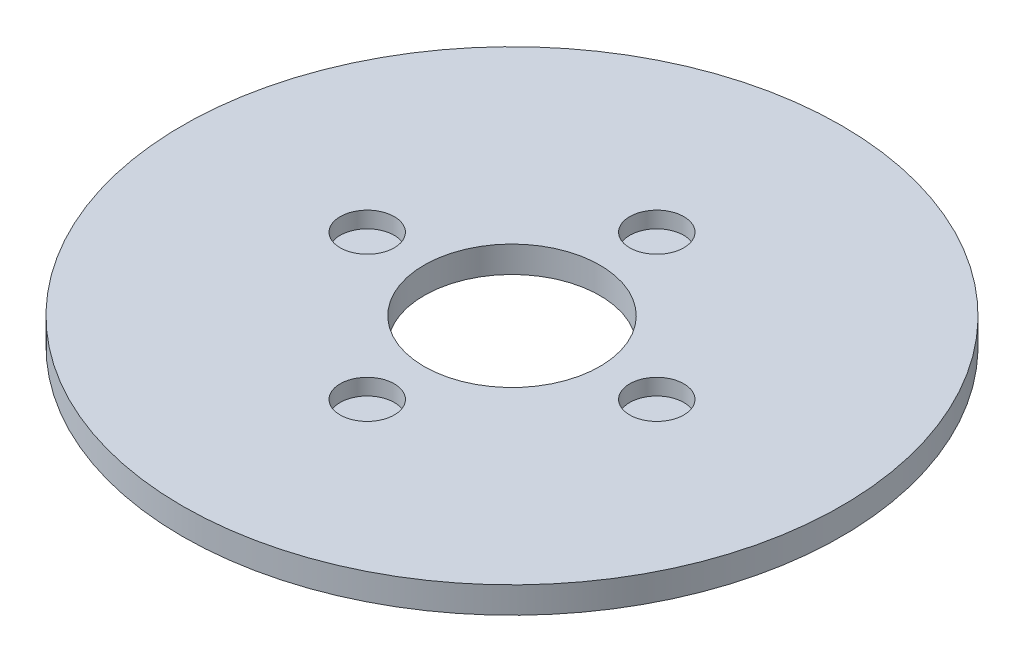
from build123d import *

# Parameters (mm, degrees)
SKETCH1_R           = 75
BOSS_EXTRUDE1_DEPTH = 6
SKETCH2_R           = 20
CUT_EXTRUDE1_DEPTH  = 107.235587258
SKETCH3_R           = 6.154505007
CUT_EXTRUDE2_DEPTH  = 3.690022139
CIRPATTERN1_COUNT   = 4


with BuildPart() as part:
    # Sketch1 → Boss-Extrude1 (new body)
    with BuildSketch(Plane(origin=(0, 0, 0), x_dir=(1, 0, 0), z_dir=(0, 1, 0))):
        Circle(SKETCH1_R)
    extrude(amount=BOSS_EXTRUDE1_DEPTH)

    # Sketch2 → Cut-Extrude1 (cut, through all)
    with BuildSketch(Plane(origin=(0, 0, 0), x_dir=(1, 0, 0), z_dir=(0, 1, 0))):
        Circle(SKETCH2_R)
    extrude(amount=CUT_EXTRUDE1_DEPTH, mode=Mode.SUBTRACT)

    # Sketch3 → Cut-Extrude2 (cut)
    with BuildSketch(Plane(origin=(0, 6, 0), x_dir=(1, 0, 0), z_dir=(0, 1, 0))):
        with Locations((-32.948980928, 0)):
            Circle(SKETCH3_R)
    cut_extrude2 = extrude(amount=-CUT_EXTRUDE2_DEPTH, mode=Mode.SUBTRACT)

    # CirPattern1: Cut-Extrude2 ×4 about axis
    cirpattern1_axis = Axis((0, 0, 0), (0, 1, 0))
    for i in range(1, CIRPATTERN1_COUNT):
        add(cut_extrude2.rotate(cirpattern1_axis, i * 360 / CIRPATTERN1_COUNT), mode=Mode.SUBTRACT)


solid = part.part
